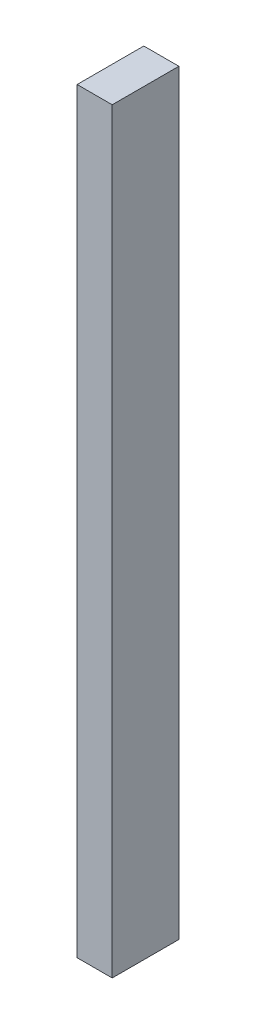
from build123d import *

# Parameters (mm, degrees)
SKETCH1_W           = 5.08
SKETCH1_H           = 9.652
BOSS_EXTRUDE1_DEPTH = 109.474


with BuildPart() as part:
    # Sketch1 → Boss-Extrude1 (new body)
    with BuildSketch(Plane(origin=(0, 0, 0), x_dir=(1, 0, 0), z_dir=(0, 1, 0))):
        with Locations((2.54, 4.826)):
            Rectangle(SKETCH1_W, SKETCH1_H)
    extrude(amount=BOSS_EXTRUDE1_DEPTH)


solid = part.part
